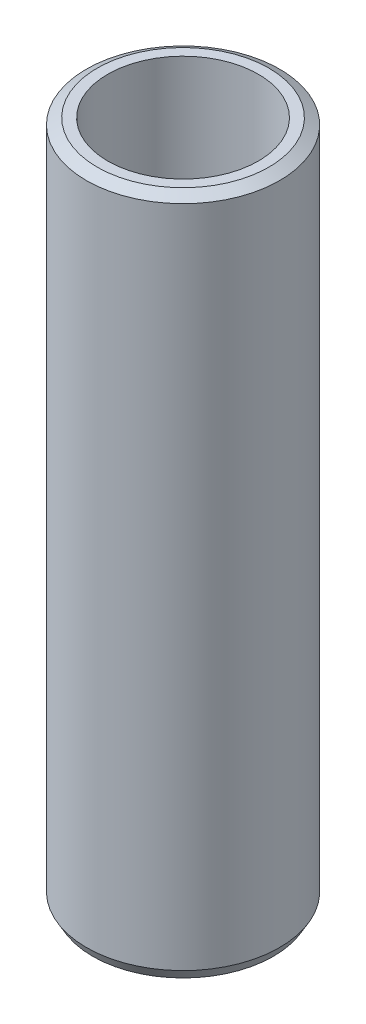
from build123d import *
from OCP.BRepFilletAPI import BRepFilletAPI_MakeChamfer

# Parameters (mm, degrees)
SKETCH1_R           = 57.5
BOSS_EXTRUDE1_DEPTH = 405.391041705
SKETCH2_R           = 44.803426233
CUT_EXTRUDE1_DEPTH  = 414.466318694
CHAMFER1_SIZE       = 3.703397454
CHAMFER1_SIZE2      = 6.414472551


with BuildPart() as part:
    # Sketch1 → Boss-Extrude1 (new body)
    with BuildSketch(Plane(origin=(0, 0, 0), x_dir=(1, 0, 0), z_dir=(0, 1, 0))):
        Circle(SKETCH1_R)
    extrude(amount=BOSS_EXTRUDE1_DEPTH)

    # Sketch2 → Cut-Extrude1 (cut, through all)
    with BuildSketch(Plane(origin=(0, 0, 0), x_dir=(1, 0, 0), z_dir=(0, 1, 0))):
        Circle(SKETCH2_R)
    extrude(amount=CUT_EXTRUDE1_DEPTH, mode=Mode.SUBTRACT)

    # Chamfer1: one chamfer whose edges measure the first distance from different faces: ONE call of the kernel's chamfer builder (chamfer() names one face for all edges)
    chamfer1_edges_1 = [part.edges().sort_by_distance(p)[0] for p in [
        (-57.5, 405.391041705, 0),
    ]]
    chamfer1_side_1 = [part.faces().sort_by_distance(p)[0] for p in [
        (-57.5, 202.695520852, 0),
    ]]
    chamfer1_edges_2 = [part.edges().sort_by_distance(p)[0] for p in [
        (-57.5, 0, 0),
    ]]
    chamfer1_side_2 = [part.faces().sort_by_distance(p)[0] for p in [
        (-55.873654403, 0, 0),
    ]]
    chamfer1 = BRepFilletAPI_MakeChamfer(part.part.solid().wrapped)
    for e in chamfer1_edges_1:
        chamfer1.Add(CHAMFER1_SIZE, CHAMFER1_SIZE2, e.wrapped, chamfer1_side_1[0].wrapped)  # the first distance lies on this face
    for e in chamfer1_edges_2:
        chamfer1.Add(CHAMFER1_SIZE, CHAMFER1_SIZE2, e.wrapped, chamfer1_side_2[0].wrapped)  # the first distance lies on this face
    add(Compound.cast(chamfer1.Shape()), mode=Mode.REPLACE)


solid = part.part
